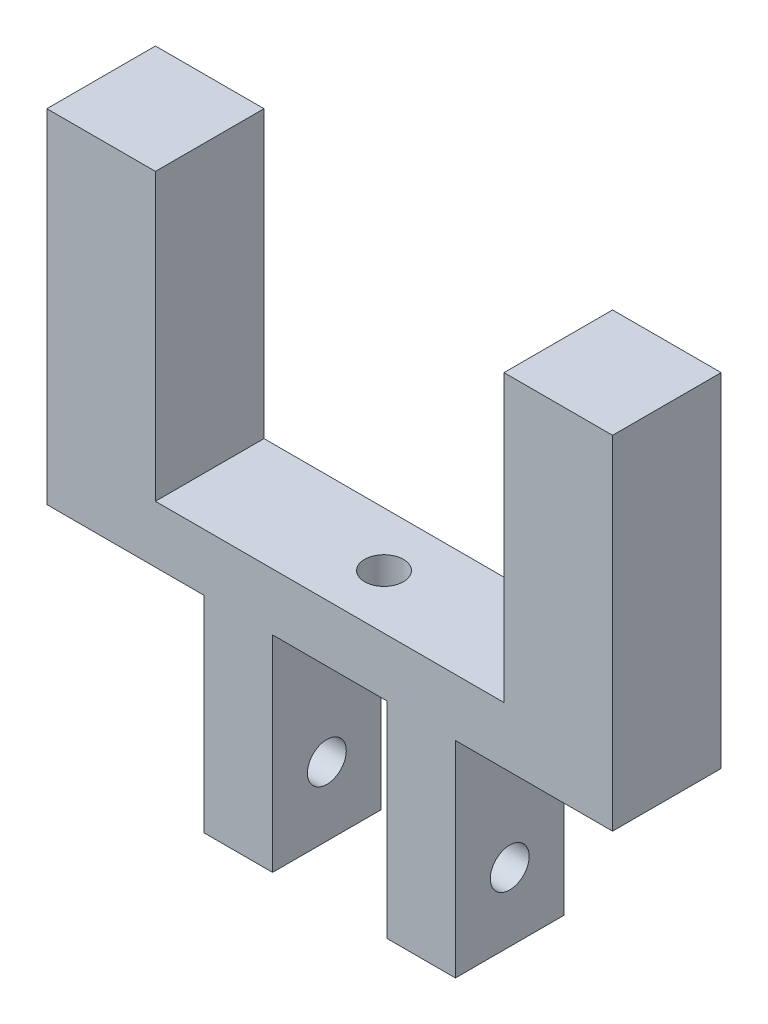
from build123d import *

# Parameters (mm, degrees)
RESSALTO_EXTRUS_O1_DEPTH = 9.5
ESBO_O2_R                = 1.7
CORTE_EXTRUS_O1_DEPTH    = 61.599608085
ESBO_O3_R                = 1.7
CORTE_EXTRUS_O2_DEPTH    = 55.834409817


with BuildPart() as part:
    # Esboço1 → Ressalto-extrusão1 (new body)
    with BuildSketch(Plane.XY):
        Polygon((-24.75, 0), (-24.75, -30), (-11, -30), (-11, -48), (-5, -48), (-5, -40), (-5, -30), (0, -30), (0, -25), (-15.25, -25), (-15.25, 0), align=None)
    ressalto_extrus_o1 = extrude(amount=RESSALTO_EXTRUS_O1_DEPTH)

    # Espelhar1: Ressalto-extrusão1 across plane
    add(ressalto_extrus_o1.mirror(Plane(origin=(0, -30, 9.5), x_dir=(0, 0, 1), z_dir=(-1, 0, 0))))

    # Esboço2 → Corte-extrusão1 (cut, through all)
    with BuildSketch(Plane(origin=(11, 0, 0), x_dir=(0, 0, -1), z_dir=(1, 0, 0))):
        with Locations((-4.75, -42)):
            Circle(ESBO_O2_R)
    extrude(amount=-CORTE_EXTRUS_O1_DEPTH, mode=Mode.SUBTRACT)

    # Esboço3 → Corte-extrusão2 (cut, through all)
    with BuildSketch(Plane(origin=(0, 0, 0), x_dir=(1, 0, 0), z_dir=(0, 1, 0))):
        with Locations((0, -4.75)):
            Circle(ESBO_O3_R)
    extrude(amount=-CORTE_EXTRUS_O2_DEPTH, mode=Mode.SUBTRACT)


solid = part.part
